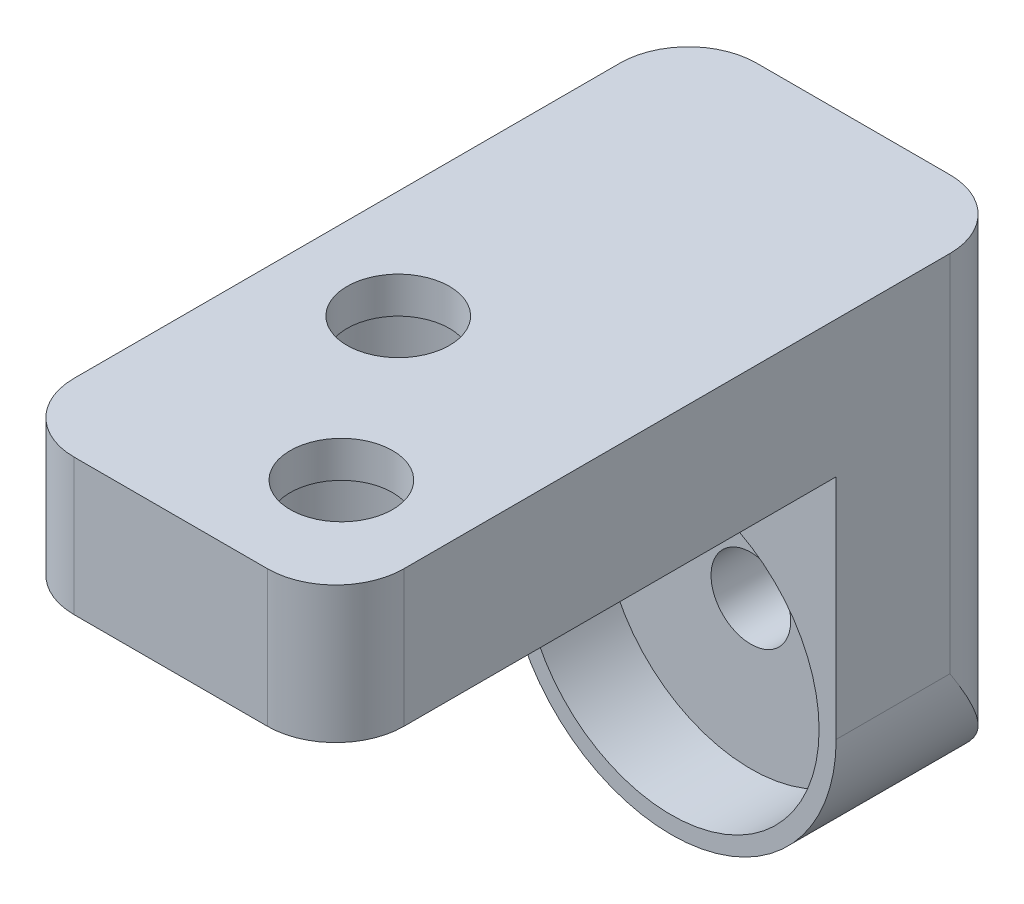
from build123d import *

# Parameters (mm, degrees)
SKIZZE1_W                                            = 14.5
SKIZZE1_H                                            = 23.25
AUFSATZ_LINEAR_AUSTRAGEN1_DEPTH                      = 30
SKIZZE5_W                                            = 22
SKIZZE5_H                                            = 17.25
SCHNITT_LINEAR_AUSTRAGEN3_DEPTH                      = 41.630191976
VERRUNDUNG1_R                                        = 7.25
STIRNSENKUNG_F_R_M4_ZYLINDERSCHRAUBE_MIT_D           = 4.5
STIRNSENKUNG_F_R_M4_ZYLINDERSCHRAUBE_MIT_CBORE_D     = 8
STIRNSENKUNG_F_R_M4_ZYLINDERSCHRAUBE_MIT_CBORE_DEPTH = 4.4
SKIZZE9_R                                            = 6.5
SCHNITT_LINEAR_AUSTRAGEN4_DEPTH                      = 3.5
SKIZZE10_R                                           = 1.75
SCHNITT_LINEAR_AUSTRAGEN5_DEPTH                      = 5.5
SKIZZE11_OUTSIDE_W                                   = 24.626
SKIZZE11_OUTSIDE_H                                   = 40.126
SCHNITT_LINEAR_AUSTRAGEN6_DEPTH                      = 41.630191976


with BuildPart() as part:
    # Skizze1 → Aufsatz-Linear austragen1 (new body)
    with BuildSketch(Plane.XY):
        with Locations((7.25, 11.625)):
            Rectangle(SKIZZE1_W, SKIZZE1_H)
    extrude(amount=AUFSATZ_LINEAR_AUSTRAGEN1_DEPTH)

    # Skizze5 → Schnitt-Linear austragen3 (cut, through all)
    with BuildSketch(Plane(origin=(14.5, 0, 0), x_dir=(0, 0, -1), z_dir=(1, 0, 0))):
        with Locations((-19, 8.625)):
            Rectangle(SKIZZE5_W, SKIZZE5_H)
    extrude(amount=-SCHNITT_LINEAR_AUSTRAGEN3_DEPTH, mode=Mode.SUBTRACT)

    # Verrundung1
    verrundung1_edges = [part.edges().sort_by_distance(p)[0] for p in [
        (14.5, 0, 4),
        (0, 0, 4),
    ]]
    fillet(verrundung1_edges, radius=VERRUNDUNG1_R - 0.0001)  # a hair under: the kernel refuses the full size

    # Stirnsenkung für M4 Zylinderschraube mit Innensechskant1 (through all)
    with Locations(Plane(origin=(0, 17.25, 0), x_dir=(-1, 0, 0), z_dir=(0, -1, 0))):
        with Locations((-4.75, -17.5), (-9.75, -25)):
            CounterBoreHole(STIRNSENKUNG_F_R_M4_ZYLINDERSCHRAUBE_MIT_D / 2, STIRNSENKUNG_F_R_M4_ZYLINDERSCHRAUBE_MIT_CBORE_D / 2, STIRNSENKUNG_F_R_M4_ZYLINDERSCHRAUBE_MIT_CBORE_DEPTH)

    # Skizze9 → Schnitt-Linear austragen4 (cut)
    with BuildSketch(Plane.XY.offset(8)):
        with Locations((7.25, 7.25)):
            Circle(SKIZZE9_R)
    extrude(amount=-SCHNITT_LINEAR_AUSTRAGEN4_DEPTH, mode=Mode.SUBTRACT)

    # Skizze10 → Schnitt-Linear austragen5 (cut)
    with BuildSketch(Plane.XY.offset(4.5)):
        with Locations((7.25, 7.25)):
            Circle(SKIZZE10_R)
    extrude(amount=-SCHNITT_LINEAR_AUSTRAGEN5_DEPTH, mode=Mode.SUBTRACT)

    # Skizze11 outside → Schnitt-Linear austragen6 (cut, through all)
    with BuildSketch(Plane(origin=(0, 23.25, 0), x_dir=(1, 0, 0), z_dir=(0, 1, 0))):
        with Locations((7.25, -15)):
            Rectangle(SKIZZE11_OUTSIDE_W, SKIZZE11_OUTSIDE_H)
        with BuildLine():
            Line((3, 0), (11.5, 0))
            ThreePointArc((11.5, 0), (13.621320344, -0.878679656), (14.5, -3))
            Line((14.5, -3), (14.5, -27))
            ThreePointArc((14.5, -27), (13.621320344, -29.121320344), (11.5, -30))
            Line((11.5, -30), (3, -30))
            ThreePointArc((3, -30), (0.878679656, -29.121320344), (0, -27))
            Line((0, -27), (0, -3))
            ThreePointArc((0, -3), (0.878679656, -0.878679656), (3, 0))
        make_face(mode=Mode.SUBTRACT)
    extrude(amount=-SCHNITT_LINEAR_AUSTRAGEN6_DEPTH, mode=Mode.SUBTRACT)


solid = part.part
